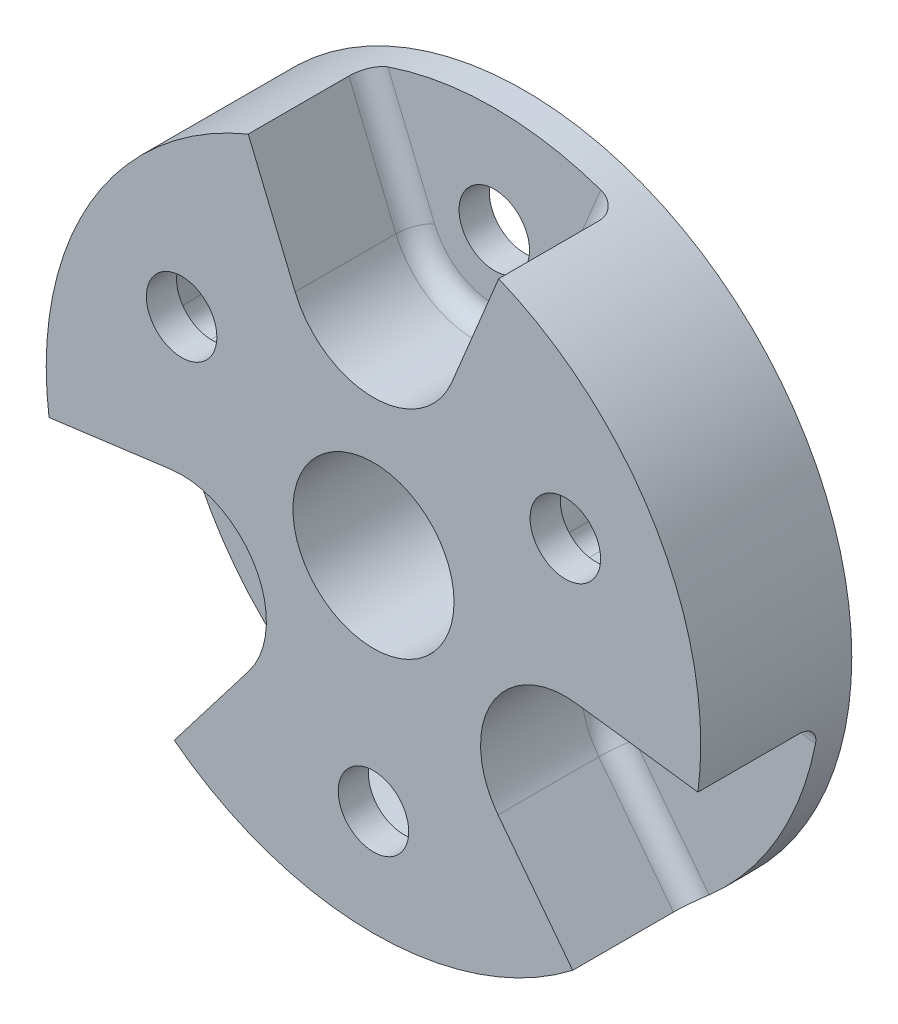
from build123d import *

# Parameters (mm, degrees)
SKETCH1_R           = 32.5
SKETCH1_R_2         = 8
BOSS_EXTRUDE1_DEPTH = 15
CUT_EXTRUDE1_START  = -12
CUT_EXTRUDE1_DEPTH  = 12
CIRPATTERN1_COUNT   = 3
SHELL2_DEPTH        = 12
SKETCH4_R           = 3.5
CUT_EXTRUDE3_DEPTH  = 48.502631506
CIRPATTERN2_COUNT   = 6
DELETEFACE1_DEPTH   = 12
FILLET1_R           = 2


# Read off the part's stored shape, not the designer's step: Shell2, DeleteFace1
with BuildPart() as part:
    # Sketch1 → Boss-Extrude1 (new body)
    with BuildSketch(Plane.XY):
        Circle(SKETCH1_R)
        Circle(SKETCH1_R_2, mode=Mode.SUBTRACT)
    extrude(amount=BOSS_EXTRUDE1_DEPTH)

    # Sketch2 → Cut-Extrude1 (cut)
    with BuildSketch(Plane.XY.offset(15).offset(CUT_EXTRUDE1_START)):
        with BuildLine():
            Line((7.778174593, 18.778174593), (12.437211552, 30.026084807))
            ThreePointArc((12.437211552, 30.026084807), (0, 32.5), (-12.437211552, 30.026084807))
            Line((-12.437211552, 30.026084807), (-7.778174593, 18.778174593))
            ThreePointArc((-7.778174593, 18.778174593), (0, 13.580964488), (7.778174593, 18.778174593))
        make_face()
    cut_extrude1 = extrude(amount=CUT_EXTRUDE1_DEPTH, mode=Mode.SUBTRACT)

    # CirPattern1: Cut-Extrude1 ×3 about axis
    cirpattern1_axis = Axis((0, 0, 0), (0, 0, 1))
    for i in range(1, CIRPATTERN1_COUNT):
        add(cut_extrude1.rotate(cirpattern1_axis, i * 360 / CIRPATTERN1_COUNT), mode=Mode.SUBTRACT)

    # Shell2 outline → Shell2 (cut)
    with BuildSketch(Plane.XY):
        with BuildLine():
            ThreePointArc((9.993228917, -17.951468376), (7.780208869, -12.824416945), (8.262997266, -7.261052003))
            ThreePointArc((8.262997266, -7.261052003), (0, -11), (-8.262997266, -7.261052003))
            ThreePointArc((-8.262997266, -7.261052003), (-7.780208869, -12.824416945), (-9.993228917, -17.951468376))
            Line((-9.993228917, -17.951468376), (-15.485298881, -25.108873303))
            ThreePointArc((-15.485298881, -25.108873303), (0, -29.5), (15.485298881, -25.108873303))
            Line((15.485298881, -25.108873303), (9.993228917, -17.951468376))
        make_face()
        with BuildLine():
            ThreePointArc((10.419754125, -3.525439542), (14.996375297, -0.325650055), (20.543042107, 0.32134408))
            Line((20.543042107, 0.32134408), (29.487571582, -0.856225565))
            ThreePointArc((29.487571582, -0.856225565), (25.547749412, 14.75), (14.0022727, 25.965098868))
            Line((14.0022727, 25.965098868), (10.549813191, 17.630124296))
            ThreePointArc((10.549813191, 17.630124296), (7.216166428, 13.150067), (2.15675686, 10.786491545))
            ThreePointArc((2.15675686, 10.786491545), (9.526279442, 5.5), (10.419754125, -3.525439542))
        make_face()
        with BuildLine():
            ThreePointArc((-14.0022727, 25.965098868), (-25.547749412, 14.75), (-29.487571582, -0.856225565))
            Line((-29.487571582, -0.856225565), (-20.543042107, 0.32134408))
            ThreePointArc((-20.543042107, 0.32134408), (-14.996375297, -0.325650055), (-10.419754125, -3.525439542))
            ThreePointArc((-10.419754125, -3.525439542), (-9.526279442, 5.5), (-2.15675686, 10.786491545))
            ThreePointArc((-2.15675686, 10.786491545), (-7.216166428, 13.150067), (-10.549813191, 17.630124296))
            Line((-10.549813191, 17.630124296), (-14.0022727, 25.965098868))
        make_face()
    extrude(amount=SHELL2_DEPTH, mode=Mode.SUBTRACT)

    # Sketch4 → Cut-Extrude3 (cut, symmetric)
    with BuildSketch(Plane.XY.offset(3)):
        with Locations((0, 22)):
            Circle(SKETCH4_R)
    cut_extrude3 = extrude(amount=CUT_EXTRUDE3_DEPTH, both=True, mode=Mode.SUBTRACT)

    # CirPattern2: Cut-Extrude3 ×6 about axis
    cirpattern2_axis = Axis((0, 0, 0), (0, 0, 1))
    for i in range(1, CIRPATTERN2_COUNT):
        add(cut_extrude3.rotate(cirpattern2_axis, i * 360 / CIRPATTERN2_COUNT), mode=Mode.SUBTRACT)

    # DeleteFace1 outline → DeleteFace1 (add)
    with BuildSketch(Plane.XY):
        with BuildLine():
            Line((-9.993228917, -17.951468376), (-4.062465375, -10.222346848))
            ThreePointArc((-4.062465375, -10.222346848), (-6.338104931, -8.990463052), (-8.262997266, -7.261052003))
            ThreePointArc((-8.262997266, -7.261052003), (-7.780208869, -12.824416945), (-9.993228917, -17.951468376))
        make_face()
        with BuildLine():
            Line((4.062465375, -10.222346848), (9.993228917, -17.951468376))
            ThreePointArc((9.993228917, -17.951468376), (7.780208869, -12.824416945), (8.262997266, -7.261052003))
            ThreePointArc((8.262997266, -7.261052003), (6.338104931, -8.990463052), (4.062465375, -10.222346848))
        make_face()
        with BuildLine():
            Line((-10.549813191, 17.630124296), (-6.821579369, 8.629371641))
            ThreePointArc((-6.821579369, 8.629371641), (-4.616916929, 9.984191408), (-2.15675686, 10.786491545))
            ThreePointArc((-2.15675686, 10.786491545), (-7.216166428, 13.150067), (-10.549813191, 17.630124296))
        make_face()
        with BuildLine():
            Line((-10.884044744, 1.592975207), (-20.543042107, 0.32134408))
            ThreePointArc((-20.543042107, 0.32134408), (-14.996375297, -0.325650055), (-10.419754125, -3.525439542))
            ThreePointArc((-10.419754125, -3.525439542), (-10.95502186, -0.993728356), (-10.884044744, 1.592975207))
        make_face()
        with BuildLine():
            Line((20.543042107, 0.32134408), (10.884044744, 1.592975207))
            ThreePointArc((10.884044744, 1.592975207), (10.95502186, -0.993728356), (10.419754125, -3.525439542))
            ThreePointArc((10.419754125, -3.525439542), (14.996375297, -0.325650055), (20.543042107, 0.32134408))
        make_face()
        with BuildLine():
            Line((6.821579369, 8.629371641), (10.549813191, 17.630124296))
            ThreePointArc((10.549813191, 17.630124296), (7.216166428, 13.150067), (2.15675686, 10.786491545))
            ThreePointArc((2.15675686, 10.786491545), (4.616916929, 9.984191408), (6.821579369, 8.629371641))
        make_face()
    extrude(amount=DELETEFACE1_DEPTH)

    # Fillet1
    fillet1_edges = [part.edges().sort_by_distance(p)[0] for p in [
        (-10.107693072, 24.4021297, 3),
        (10.884044744, 1.592975207, 6),
        (0, 13.580964488, 3),
        (-6.821579369, 8.629371641, 6),
        (10.107693072, 24.4021297, 3),
        (-4.062465375, -10.222346848, 6),
        (-10.884044744, 1.592975207, 6),
        (4.062465375, -10.222346848, 6),
        (6.821579369, 8.629371641, 6),
        (26.186710763, -3.447545876, 3),
        (11.761460254, -6.790482244, 3),
        (16.07901769, -20.954583824, 3),
        (-16.07901769, -20.954583824, 3),
        (-11.761460254, -6.790482244, 3),
        (-26.186710763, -3.447545876, 3),
        (9.526279442, 5.5, 12),
        (25.547749412, 14.75, 12),
        (8.68569628, 13.129747969, 12),
        (14.0022727, 25.965098868, 6),
        (15.713543426, 0.957159644, 12),
        (29.487571582, -0.856225565, 6),
        (-8.68569628, 13.129747969, 12),
        (-14.0022727, 25.965098868, 6),
        (-9.526279442, 5.5, 12),
        (-25.547749412, 14.75, 12),
        (-15.713543426, 0.957159644, 12),
        (-29.487571582, -0.856225565, 6),
        (-7.027847146, -14.086907612, 12),
        (-15.485298881, -25.108873303, 6),
        (0, -29.5, 12),
        (7.027847146, -14.086907612, 12),
        (15.485298881, -25.108873303, 6),
        (0, -11, 12),
    ]]
    fillet(fillet1_edges, radius=FILLET1_R)


solid = part.part
